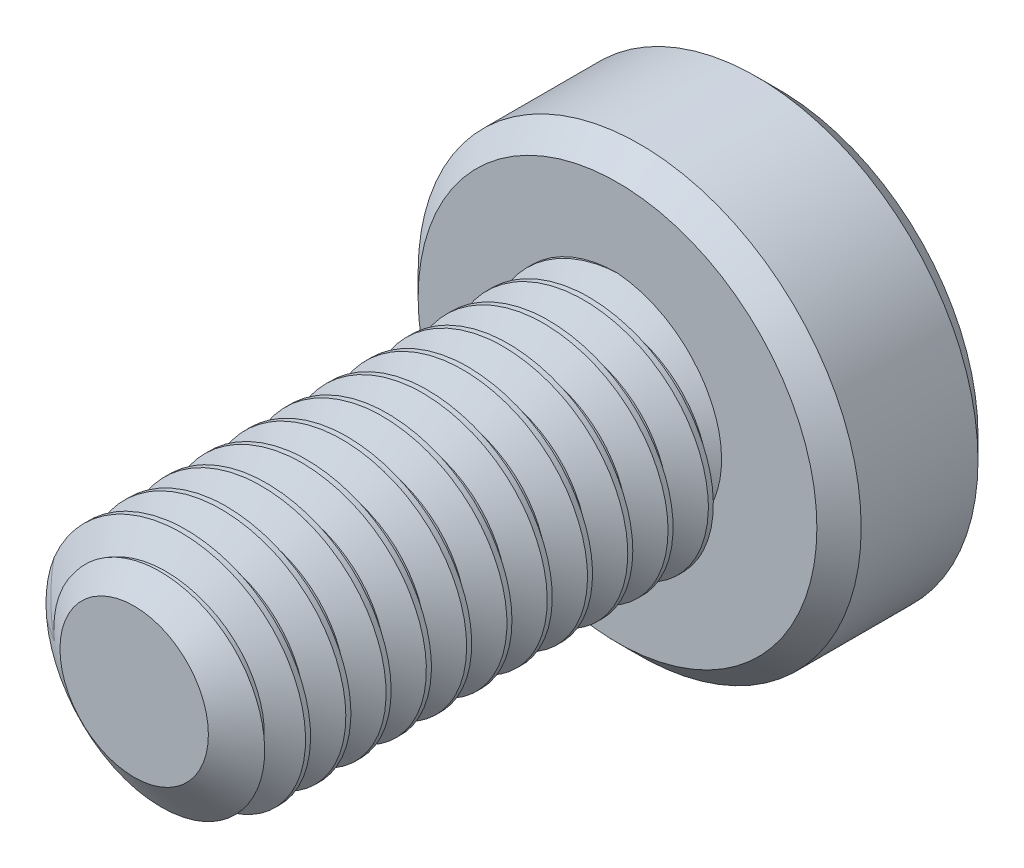
from build123d import *

# Parameters (mm, degrees)
SKETCH1_R          = 1.5
EXTRUDE1_DEPTH     = 6
CUT_SWEEP1_PITCH   = 0.5
SKETCH6_R          = 2.75
EXTRUDE2_DEPTH     = 2
CUT_EXTRUDE1_DEPTH = 1.5
CHAMFER1_SIZE      = 0.275


with BuildPart() as part:
    # Sketch1 → Extrude1 (new body)
    with BuildSketch(Plane.XY):
        Circle(SKETCH1_R)
    extrude(amount=-EXTRUDE1_DEPTH)

    # Cut-Sweep1: the profile of Sketch3 profile screwed along a right-hand helix of 13 turns, 6 arcs to a turn; built about Z, then put on its axis
    cut_sweep1_z = Axis((0, 0, 0), (0, 0, 1))
    cut_sweep1_corners = [(1.5003, 0, -0.437673205), (1.175240474, 0, -0.25), (1.175240474, 0, -0.1875), (1.5003, 0, 0.000173205)]
    with BuildLine(mode=Mode.PRIVATE) as cut_sweep1_profile:
        Line(cut_sweep1_corners[0], cut_sweep1_corners[1])
        Line(cut_sweep1_corners[1], cut_sweep1_corners[2])
        Line(cut_sweep1_corners[2], cut_sweep1_corners[3])
        Line(cut_sweep1_corners[3], cut_sweep1_corners[0])
    cut_sweep1_cap = Face(cut_sweep1_profile.wire())
    cut_sweep1_turn_angles = [0, 30, 60, 90, 120, 150, 180, 210, 240, 270, 300, 330, 360]
    cut_sweep1_turn_weights = [1, 0.8660254037844387, 1, 0.8660254037844387, 1, 0.8660254037844387, 1, 0.8660254037844387, 1, 0.8660254037844387, 1, 0.8660254037844387, 1]
    cut_sweep1_turn_rails = [Edge.make_bspline([Vector(p[0], p[1], 0).rotate(cut_sweep1_z, cut_sweep1_turn_angles[k]) / cut_sweep1_turn_weights[k] + Vector(0, 0, p[2] + CUT_SWEEP1_PITCH * cut_sweep1_turn_angles[k] / 360) for k in range(13)], [0, 0, 0, 1, 1, 2, 2, 3, 3, 4, 4, 5, 5, 6, 6, 6], 2, cut_sweep1_turn_weights) for p in cut_sweep1_corners]
    cut_sweep1_turn_sides = [Face.make_surface_from_curves(cut_sweep1_turn_rails[p[0]], cut_sweep1_turn_rails[p[1]]) for p in [(0, 1), (1, 2), (2, 3), (3, 0)]]
    cut_sweep1 = Plane(origin=(0, 0, 0), x_dir=(0, 1, 0), z_dir=(0, 0, -1)) * Solid(Shell([*[p.moved(Location((0, 0, CUT_SWEEP1_PITCH * i))) for i in range(13) for p in cut_sweep1_turn_sides], cut_sweep1_cap, cut_sweep1_cap.rotate(cut_sweep1_z, 4680).moved(Location((0, 0, CUT_SWEEP1_PITCH * 4680 / 360)))]))
    add(cut_sweep1, mode=Mode.SUBTRACT)

    # Sketch4 → Cut-Revolve1 (revolve, cut)
    with BuildSketch(Plane(origin=(0, 0, 0), x_dir=(0, 0, -1), z_dir=(1, 0, 0)), mode=Mode.PRIVATE) as cut_revolve1_sk:
        Polygon((0.405251783, 1.5), (0, 0.921240474), (0, 1.5), align=None)
    revolve(cut_revolve1_sk.sketch.rotate(Axis((0, 0, 0), (0, 0, -1)), 263.352109169), axis=Axis((0, 0, 0), (0, 0, -1)), mode=Mode.SUBTRACT)

    # Sketch6 → Extrude2 (add)
    with BuildSketch(Plane(origin=(0, 0, -6), x_dir=(-1, 0, 0), z_dir=(0, 0, -1))):
        Circle(SKETCH6_R)
    extrude(amount=EXTRUDE2_DEPTH)

    # Sketch7 → Cut-Extrude1 (cut)
    with BuildSketch(Plane(origin=(0, 0, -8), x_dir=(-1, 0, 0), z_dir=(0, 0, -1))):
        Polygon((0, 1.154700538), (-1, 0.577350269), (-1, -0.577350269), (0, -1.154700538), (1, -0.577350269), (1, 0.577350269), align=None)
    extrude(amount=-CUT_EXTRUDE1_DEPTH, mode=Mode.SUBTRACT)

    # Cut-Extrude2 cone 1 section (through the dimple's axis) → Cut-Extrude2 (revolve, cut)
    with BuildSketch(Plane(origin=(0, 0, -8), x_dir=(0, 1, 0), z_dir=(1, 0, 0))):
        Polygon((0, 0), (1.154700538, 0), (0, 1.154700538), align=None)
    revolve(axis=Axis((0, 0, -8), (0, 0, 1)), mode=Mode.SUBTRACT)

    # Chamfer1
    chamfer1_edges = [part.edges().sort_by_distance(p)[0] for p in [
        (2.75, 0, -6),
        (2.75, 0, -8),
    ]]
    chamfer(chamfer1_edges, length=CHAMFER1_SIZE)


solid = part.part
